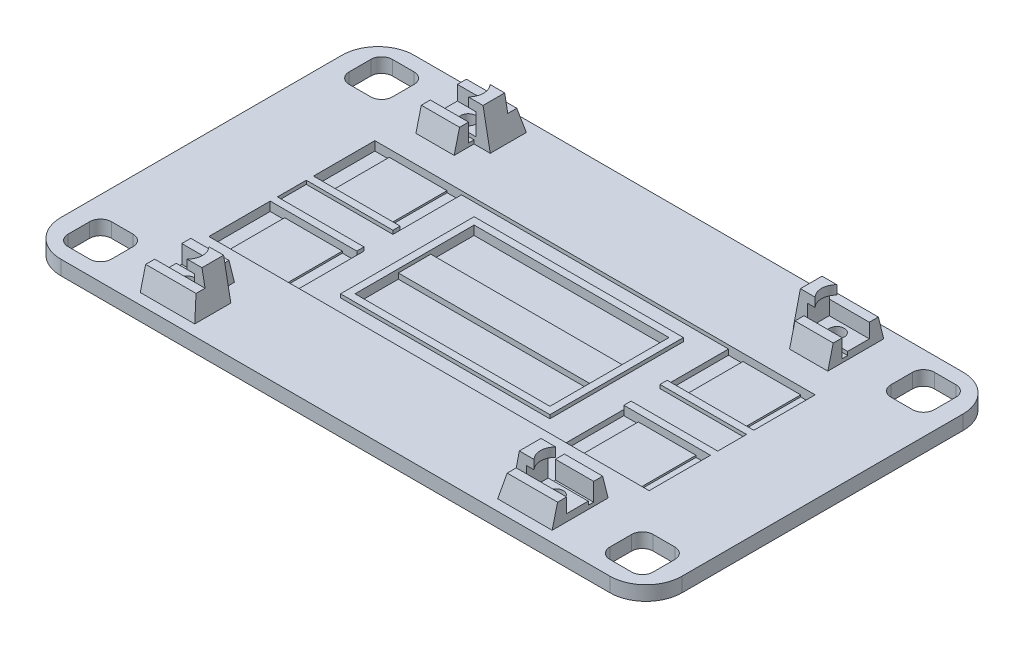
from build123d import *

# Parameters (mm, degrees)
SKETCH1_W                        = 34.5
SKETCH1_H                        = 8.741142107
BOSS_EXTRUDE3_DEPTH              = 4
SKETCH6_W                        = 11
SKETCH6_H                        = 11
BOSS_EXTRUDE4_DEPTH              = 2
CUT_EXTRUDE1_START               = -3
CUT_EXTRUDE1_DEPTH               = 24
SKETCH7_W                        = 11
SKETCH7_H                        = 2.5
SKETCH7_H_2                      = 1
BOSS_EXTRUDE5_DEPTH              = 4
SKETCH10_W                       = 3.083691557
SKETCH10_H                       = 13.597950321
CUT_EXTRUDE2_DEPTH               = 12
SKETCH11_W                       = 10.179154034
SKETCH11_H                       = 1.5
BOSS_EXTRUDE7_DEPTH              = 6
SKETCH12_W                       = 2.5
SKETCH12_H                       = 12.5
BOSS_EXTRUDE8_DEPTH              = 6
BOSS_EXTRUDE9_DEPTH              = 11.6
SKETCH21_R                       = 4.5
CUT_EXTRUDE9_DEPTH               = 3
CUT_EXTRUDE11_DEPTH              = 11.5
BOSS_EXTRUDE14_DEPTH             = 4
CUT_EXTRUDE12_START              = -1
SKETCH28_W                       = 13.111544153
SKETCH28_H                       = 1.5
CUT_EXTRUDE12_DEPTH              = 11
BOSS_EXTRUDE15_DEPTH             = 1.5
SKETCH30_W                       = 2.5
SKETCH30_H                       = 6
BOSS_EXTRUDE16_DEPTH             = 2
SKETCH31_W                       = 2.5
SKETCH31_H                       = 6
BOSS_EXTRUDE17_DEPTH             = 2.5
BOSS_EXTRUDE18_REACH             = 127.805
BOSS_EXTRUDE18_DIRECTION_2_REACH = 127.805
SKETCH34_W                       = 17.603907028
SKETCH34_H                       = 5.411961877
SKETCH34_H_2                     = 6.558600434
CUT_EXTRUDE13_DEPTH              = 4.5
BOSS_EXTRUDE20_DEPTH             = 11.6
MIRROR11_OUTLINE_R               = 4.5
MIRROR11_DEPTH                   = 3
MIRROR11_START                   = 3
MIRROR11_2_OUTLINE_R             = 2.069860115
MIRROR11_2_DEPTH                 = 1
MIRROR11_START_2                 = 4
MIRROR11_3_OUTLINE_R             = 2.069860115
MIRROR11_3_DEPTH                 = 2
MIRROR11_START_3                 = 6
MIRROR11_4_DEPTH                 = 4
MIRROR11_5_OUTLINE_W             = 13.1
MIRROR11_5_OUTLINE_H             = 1.5
MIRROR11_5_DEPTH                 = 1
MIRROR11_START_4                 = 12
MIRROR11_6_DEPTH                 = 2.5
MIRROR11_START_5                 = -59.844904725
MIRROR11_7_OUTLINE_W             = 6
MIRROR11_7_OUTLINE_H             = 2.5
MIRROR11_7_DEPTH                 = 15.1
MIRROR11_START_6                 = -49.244904725
MIRROR11_8_OUTLINE_W             = 10.5
MIRROR11_8_OUTLINE_H             = 6
MIRROR11_8_DEPTH                 = 4.5
MIRROR11_START_7                 = -46.744904725
MIRROR11_9_OUTLINE_W             = 6
MIRROR11_9_OUTLINE_H             = 1.5
MIRROR11_9_DEPTH                 = 2
MIRROR11_10_DEPTH                = 1.5
MIRROR11_START_8                 = -43.206197131
MIRROR11_11_DEPTH                = 3.206197131
BOSS_EXTRUDE21_REACH             = 154.22
CUT_EXTRUDE14_START              = -5
SKETCH37_W                       = 89.881860183
SKETCH37_H                       = 1.5
SKETCH37_W_2                     = 87.938782422
CUT_EXTRUDE14_DEPTH              = 5
SKETCH39_W                       = 7.636808492
SKETCH39_H                       = 7.005250269
CUT_EXTRUDE18_DEPTH              = 6
MIRROR13_COPY_1_SKETCH_W         = 7.636808492
MIRROR13_COPY_1_SKETCH_H         = 7.005250269
MIRROR13_COPY_1_DEPTH            = 6
SKETCH41_W                       = 6
SKETCH41_H                       = 6
CUT_EXTRUDE20_DEPTH              = 0.5
SKETCH42_W                       = 122
SKETCH42_H                       = 46
CUT_EXTRUDE21_DEPTH              = 1
SKETCH43_W                       = 24
SKETCH43_H                       = 2
BOSS_EXTRUDE23_DEPTH             = 1
SKETCH44_W                       = 4
SKETCH44_H                       = 17
CUT_EXTRUDE22_DEPTH              = 1.5
SKETCH45_W                       = 16
SKETCH45_H                       = 17
CUT_EXTRUDE23_DEPTH              = 1
SKETCH46_W                       = 58
SKETCH46_H                       = 37
SKETCH46_W_2                     = 54
SKETCH46_H_2                     = 33
BOSS_EXTRUDE25_DEPTH             = 1
SKETCH47_W                       = 54
SKETCH47_H                       = 12
CUT_EXTRUDE24_DEPTH              = 1.5


with BuildPart() as part:
    # Sketch1 → Boss-Extrude3 (new body)
    # profile 1 of 11: a face of its own
    with BuildSketch(Plane(origin=(0, 0, 0), x_dir=(1, 0, 0), z_dir=(0, 1, 0))):
        with BuildLine():
            Line((73.923306644, 42.779769086), (-59.063365063, 42.779769086))
            ThreePointArc((-59.063365063, 42.779769086), (-65.244285922, 40.219547838), (-67.804507169, 34.03862698))
            Line((-67.804507169, 34.03862698), (-67.804507169, -34.03862698))
            ThreePointArc((-67.804507169, -34.03862698), (-65.244285922, -40.219547838), (-59.063365063, -42.779769086))
            Line((-59.063365063, -42.779769086), (73.923306644, -42.779769086))
            ThreePointArc((73.923306644, -42.779769086), (80.104227503, -40.219547838), (82.664448751, -34.03862698))
            Line((82.664448751, -34.03862698), (82.664448751, 34.03862698))
            ThreePointArc((82.664448751, 34.03862698), (80.104227503, 40.219547838), (73.923306644, 42.779769086))
        make_face()
        with Locations((61.043877697, 34.03862698)):
            Rectangle(SKETCH1_W, SKETCH1_H, mode=Mode.SUBTRACT)
    # profile 2 of 11: a face of its own
    with BuildSketch(Plane(origin=(0, 0, 0), x_dir=(1, 0, 0), z_dir=(0, 1, 0))):
        with BuildLine():
            Line((78.293877697, 29.668055926), (78.293877697, 34.03862698))
            Line((78.293877697, 34.03862698), (74.273170351, 34.03862698))
            ThreePointArc((74.273170351, 34.03862698), (72.293877697, 32.059334326), (70.314585044, 34.03862698))
            Line((70.314585044, 34.03862698), (50.363737812, 34.03862698))
            ThreePointArc((50.363737812, 34.03862698), (48.293877697, 31.968766864), (46.224017582, 34.03862698))
            Line((46.224017582, 34.03862698), (43.793877697, 34.03862698))
            Line((43.793877697, 34.03862698), (43.793877697, 29.668055926))
            Line((43.793877697, 29.668055926), (78.293877697, 29.668055926))
        make_face()
    # profile 3 of 11: a face of its own
    with BuildSketch(Plane(origin=(0, 0, 0), x_dir=(1, 0, 0), z_dir=(0, 1, 0))):
        with BuildLine():
            Line((78.293877697, 34.03862698), (78.293877697, 38.409198033))
            Line((78.293877697, 38.409198033), (43.793877697, 38.409198033))
            Line((43.793877697, 38.409198033), (43.793877697, 34.03862698))
            Line((43.793877697, 34.03862698), (46.224017582, 34.03862698))
            ThreePointArc((46.224017582, 34.03862698), (48.293877697, 36.108487095), (50.363737812, 34.03862698))
            Line((50.363737812, 34.03862698), (70.314585044, 34.03862698))
            ThreePointArc((70.314585044, 34.03862698), (72.293877697, 36.017919633), (74.273170351, 34.03862698))
            Line((74.273170351, 34.03862698), (78.293877697, 34.03862698))
        make_face()
    # profile 4 of 11: a face of its own
    with BuildSketch(Plane(origin=(0, 0, 0), x_dir=(1, 0, 0), z_dir=(0, 1, 0))):
        with BuildLine():
            ThreePointArc((70.314585044, 34.03862698), (72.293877697, 32.059334326), (74.273170351, 34.03862698))
            Line((74.273170351, 34.03862698), (70.314585044, 34.03862698))
        make_face()
    # profile 5 of 11: a face of its own
    with BuildSketch(Plane(origin=(0, 0, 0), x_dir=(1, 0, 0), z_dir=(0, 1, 0))):
        with BuildLine():
            Line((70.314585044, 34.03862698), (74.273170351, 34.03862698))
            ThreePointArc((74.273170351, 34.03862698), (72.293877697, 36.017919633), (70.314585044, 34.03862698))
        make_face()
    # profile 6 of 11: a face of its own
    with BuildSketch(Plane(origin=(0, 0, 0), x_dir=(1, 0, 0), z_dir=(0, 1, 0))):
        with BuildLine():
            ThreePointArc((70.314585044, 34.03862698), (72.293877697, 32.059334326), (74.273170351, 34.03862698))
            Line((74.273170351, 34.03862698), (70.314585044, 34.03862698))
        make_face()
    # profile 7 of 11: a face of its own
    with BuildSketch(Plane(origin=(0, 0, 0), x_dir=(1, 0, 0), z_dir=(0, 1, 0))):
        with BuildLine():
            Line((70.314585044, 34.03862698), (74.273170351, 34.03862698))
            ThreePointArc((74.273170351, 34.03862698), (72.293877697, 36.017919633), (70.314585044, 34.03862698))
        make_face()
    # profile 8 of 11: a face of its own
    with BuildSketch(Plane(origin=(0, 0, 0), x_dir=(1, 0, 0), z_dir=(0, 1, 0))):
        with BuildLine():
            ThreePointArc((50.363737812, 34.03862698), (48.293877697, 36.108487095), (46.224017582, 34.03862698))
            Line((46.224017582, 34.03862698), (50.363737812, 34.03862698))
        make_face()
    # profile 9 of 11: a face of its own
    with BuildSketch(Plane(origin=(0, 0, 0), x_dir=(1, 0, 0), z_dir=(0, 1, 0))):
        with BuildLine():
            Line((50.363737812, 34.03862698), (46.224017582, 34.03862698))
            ThreePointArc((46.224017582, 34.03862698), (48.293877697, 31.968766864), (50.363737812, 34.03862698))
        make_face()
    # profile 10 of 11: a face of its own
    with BuildSketch(Plane(origin=(0, 0, 0), x_dir=(1, 0, 0), z_dir=(0, 1, 0))):
        with BuildLine():
            ThreePointArc((50.363737812, 34.03862698), (48.293877697, 36.108487095), (46.224017582, 34.03862698))
            Line((46.224017582, 34.03862698), (50.363737812, 34.03862698))
        make_face()
    # profile 11 of 11: a face of its own
    with BuildSketch(Plane(origin=(0, 0, 0), x_dir=(1, 0, 0), z_dir=(0, 1, 0))):
        with BuildLine():
            Line((50.363737812, 34.03862698), (46.224017582, 34.03862698))
            ThreePointArc((46.224017582, 34.03862698), (48.293877697, 31.968766864), (50.363737812, 34.03862698))
        make_face()
    extrude(amount=BOSS_EXTRUDE3_DEPTH)

    # Sketch6 → Boss-Extrude4 (add)
    with BuildSketch(Plane(origin=(0, 4, 0), x_dir=(1, 0, 0), z_dir=(0, 1, 0))):
        with Locations((48.114723663, 34.03862698)):
            Rectangle(SKETCH6_W, SKETCH6_H)
    boss_extrude4 = extrude(amount=BOSS_EXTRUDE4_DEPTH)

    # Sketch1<5> → Cut-Extrude1 (cut)
    with BuildSketch(Plane(origin=(0, 0, 0), x_dir=(1, 0, 0), z_dir=(0, 1, 0)).offset(CUT_EXTRUDE1_START)):
        with BuildLine():
            ThreePointArc((50.363737812, 34.03862698), (48.293877697, 36.108487095), (46.224017582, 34.03862698))
            Line((46.224017582, 34.03862698), (50.363737812, 34.03862698))
        make_face()
        with BuildLine():
            Line((50.363737812, 34.03862698), (46.224017582, 34.03862698))
            ThreePointArc((46.224017582, 34.03862698), (48.293877697, 31.968766864), (50.363737812, 34.03862698))
        make_face()
    cut_extrude1 = extrude(amount=CUT_EXTRUDE1_DEPTH, mode=Mode.SUBTRACT)

    # Sketch7 → Boss-Extrude5 (add)
    with BuildSketch(Plane(origin=(0, 6, 0), x_dir=(1, 0, 0), z_dir=(0, 1, 0))):
        with Locations((48.114723663, 38.28862698)):
            Rectangle(SKETCH7_W, SKETCH7_H)
        with Locations((48.114723663, 29.03862698)):
            Rectangle(SKETCH7_W, SKETCH7_H_2)
    boss_extrude5 = extrude(amount=BOSS_EXTRUDE5_DEPTH)

    # Sketch10 → Cut-Extrude2 (cut)
    with BuildSketch(Plane(origin=(0, 4, 0), x_dir=(1, 0, 0), z_dir=(0, 1, 0))):
        with Locations((54.335723476, 34.069991953)):
            Rectangle(SKETCH10_W, SKETCH10_H)
    cut_extrude2 = extrude(amount=CUT_EXTRUDE2_DEPTH, mode=Mode.SUBTRACT)

    # Sketch11 → Boss-Extrude7 (add)
    with BuildSketch(Plane(origin=(0, 4, 0), x_dir=(1, 0, 0), z_dir=(0, 1, 0))):
        with Locations((47.70430068, 27.78862698)):
            Rectangle(SKETCH11_W, SKETCH11_H)
    boss_extrude7 = extrude(amount=BOSS_EXTRUDE7_DEPTH)

    # Sketch12 → Boss-Extrude8 (add)
    with BuildSketch(Plane(origin=(0, 4, 0), x_dir=(1, 0, 0), z_dir=(0, 1, 0))):
        with Locations((42.443877697, 33.28862698)):
            Rectangle(SKETCH12_W, SKETCH12_H)
    boss_extrude8 = extrude(amount=BOSS_EXTRUDE8_DEPTH)

    # Sketch13 → Boss-Extrude9 (add)
    with BuildSketch(Plane.ZY.offset(-41.193877697)):
        Polygon((-27.03862698, 10), (-27.03862698, 4), (-25.53862698, 4), align=None)
        Polygon((-39.53862698, 10), (-39.53862698, 4), (-41.03862698, 4), align=None)
    extrude(amount=-BOSS_EXTRUDE9_DEPTH)

    # Sketch21 → Cut-Extrude9 (cut)
    with BuildSketch(Plane.XZ):
        with Locations(Location((48.293877697, -34.03862698, 0), (0, 0, 270))):
            Circle(SKETCH21_R)
    cut_extrude9 = extrude(amount=-CUT_EXTRUDE9_DEPTH, mode=Mode.SUBTRACT)

    # Sketch24 → Cut-Extrude11 (cut)
    with BuildSketch(Plane(origin=(0, 4, 0), x_dir=(1, 0, 0), z_dir=(0, 1, 0))):
        with BuildLine():
            Line((69.293877697, 40.03862698), (75.293877697, 40.03862698))
            ThreePointArc((75.293877697, 40.03862698), (77.415198041, 39.159947323), (78.293877697, 37.03862698))
            Line((78.293877697, 37.03862698), (78.293877697, 31.03862698))
            ThreePointArc((78.293877697, 31.03862698), (77.415198041, 28.917306636), (75.293877697, 28.03862698))
            Line((75.293877697, 28.03862698), (69.293877697, 28.03862698))
            ThreePointArc((69.293877697, 28.03862698), (67.172557354, 28.917306636), (66.293877697, 31.03862698))
            Line((66.293877697, 31.03862698), (66.293877697, 37.03862698))
            ThreePointArc((66.293877697, 37.03862698), (67.172557354, 39.159947323), (69.293877697, 40.03862698))
        make_face()
    cut_extrude11 = extrude(amount=-CUT_EXTRUDE11_DEPTH, mode=Mode.SUBTRACT)

    # Sketch26 → Boss-Extrude14 (add)
    with BuildSketch(Plane.XZ):
        with BuildLine():
            Line((-78.844904725, 53.842790723), (73.293877697, 53.842790723))
            ThreePointArc((73.293877697, 53.842790723), (80.364945509, 50.913858534), (83.293877697, 43.842790723))
            Line((83.293877697, 43.842790723), (83.293877697, -34.03862698))
            ThreePointArc((83.293877697, -34.03862698), (80.364945509, -41.109694791), (73.293877697, -44.03862698))
            Line((73.293877697, -44.03862698), (-78.844904725, -44.03862698))
            ThreePointArc((-78.844904725, -44.03862698), (-85.915972537, -41.109694791), (-88.844904725, -34.03862698))
            Line((-88.844904725, -34.03862698), (-88.844904725, 43.842790723))
            ThreePointArc((-88.844904725, 43.842790723), (-85.915972537, 50.913858534), (-78.844904725, 53.842790723))
        make_face()
        Polygon((39.621658068, -22.50744652), (81.471959084, -23.594467326), (79.917902441, -39.014138958), (77.090986998, -41.323408937), (59.598365076, -40.869055121), (39.621658068, -40.350179614), align=None, mode=Mode.SUBTRACT)
    extrude(amount=-BOSS_EXTRUDE14_DEPTH)

    # Sketch28 → Cut-Extrude12 (cut)
    with BuildSketch(Plane(origin=(0, 6, 0), x_dir=(1, 0, 0), z_dir=(0, 1, 0)).offset(CUT_EXTRUDE12_START)):
        with Locations((46.238105621, 30.28862698)):
            Rectangle(SKETCH28_W, SKETCH28_H)
    cut_extrude12 = extrude(amount=CUT_EXTRUDE12_DEPTH, mode=Mode.SUBTRACT)

    # Sketch29 → Boss-Extrude15 (add)
    with BuildSketch(Plane(origin=(52.793877697, 0, 0), x_dir=(0, 0, -1), z_dir=(1, 0, 0))):
        Polygon((37.03862698, 6), (31.03862698, 6), (31.03862698, 5), (29.53862698, 5), (29.53862698, 10), (27.03862698, 10), (25.53862698, 4), (41.03862698, 4), (39.53862698, 10), (37.03862698, 10), align=None)
    boss_extrude15 = extrude(amount=BOSS_EXTRUDE15_DEPTH)

    # Sketch30 → Boss-Extrude16 (add)
    with BuildSketch(Plane(origin=(0, 10, 0), x_dir=(1, 0, 0), z_dir=(0, 1, 0))):
        with Locations((42.443877697, 34.03862698)):
            Rectangle(SKETCH30_W, SKETCH30_H)
    boss_extrude16 = extrude(amount=BOSS_EXTRUDE16_DEPTH)

    # Sketch31 → Boss-Extrude17 (add)
    with BuildSketch(Plane(origin=(0, 12, 0), x_dir=(1, 0, 0), z_dir=(0, 1, 0))):
        with Locations((42.443877697, 34.03862698)):
            Rectangle(SKETCH31_W, SKETCH31_H)
        with BuildLine():
            Line((45.283479053, 37.03862698), (43.693877697, 37.03862698))
            Line((43.693877697, 37.03862698), (43.693877697, 31.03862698))
            Line((43.693877697, 31.03862698), (45.283479053, 31.03862698))
            ThreePointArc((45.283479053, 31.03862698), (44.043877697, 34.03862698), (45.283479053, 37.03862698))
        make_face()
    boss_extrude17 = extrude(amount=BOSS_EXTRUDE17_DEPTH)

    # Boss-Extrude18: up to this plane
    boss_extrude18_end = Plane(origin=(58.978536136, 4, -25.53862698), z_dir=(0, 0.2425356250363332, 0.9701425001453319))
    # Sketch33 → Boss-Extrude18 (add, up to the surface)
    with BuildSketch(Plane.XY.offset(-34.03862698), mode=Mode.PRIVATE) as boss_extrude18_sk1:
        Polygon((41.193877697, 14.5), (39.193877697, 4), (41.193877697, 4), align=None)
    boss_extrude18_tool1 = split(extrude(boss_extrude18_sk1.sketch, amount=BOSS_EXTRUDE18_REACH, mode=Mode.PRIVATE), bisect_by=boss_extrude18_end, keep=Keep.BOTH, mode=Mode.PRIVATE)
    boss_extrude18 = boss_extrude18_tool1.solids().sort_by_distance((40.527211, 7.5, -34.038627))[0]
    add(boss_extrude18)

    # Boss-Extrude18 direction 2: up to this plane
    boss_extrude18_direction_2_end = Plane(origin=(58.978536136, 4, -41.03862698), z_dir=(0, 0.2425356250363332, -0.9701425001453319))
    # Sketch33 → Boss-Extrude18 direction 2 (add, up to the surface)
    with BuildSketch(Plane.XY.offset(-34.03862698), mode=Mode.PRIVATE) as boss_extrude18_direction_2_sk1:
        Polygon((41.193877697, 14.5), (39.193877697, 4), (41.193877697, 4), align=None)
    boss_extrude18_direction_2_tool1 = split(extrude(boss_extrude18_direction_2_sk1.sketch, amount=-BOSS_EXTRUDE18_DIRECTION_2_REACH, mode=Mode.PRIVATE), bisect_by=boss_extrude18_direction_2_end, keep=Keep.BOTH, mode=Mode.PRIVATE)
    boss_extrude18_direction_2 = boss_extrude18_direction_2_tool1.solids().sort_by_distance((40.527211, 7.5, -34.038627))[0]
    add(boss_extrude18_direction_2)
    boss_extrude18 = boss_extrude18 + boss_extrude18_direction_2  # both directions under the feature's name, for the pattern or mirror that repeats it

    # Sketch34 → Cut-Extrude13 (cut)
    with BuildSketch(Plane(origin=(0, 14.5, 0), x_dir=(1, 0, 0), z_dir=(0, 1, 0))):
        with Locations((45.491924183, 39.744607919)):
            Rectangle(SKETCH34_W, SKETCH34_H)
        with Locations((45.491924183, 27.759326763)):
            Rectangle(SKETCH34_W, SKETCH34_H_2)
    cut_extrude13 = extrude(amount=-CUT_EXTRUDE13_DEPTH, mode=Mode.SUBTRACT)

    # Mirror9: Boss-Extrude4, Cut-Extrude1, Boss-Extrude5, Cut-Extrude2, Boss-Extrude7, Boss-Extrude8, Cut-Extrude9, Cut-Extrude11, Cut-Extrude12, Boss-Extrude15, Boss-Extrude16, Boss-Extrude17, Boss-Extrude18, Cut-Extrude13 across plane
    add(boss_extrude4.mirror(Plane.XY.offset(4.902081871)))
    add(cut_extrude1.mirror(Plane.XY.offset(4.902081871)), mode=Mode.SUBTRACT)
    add(boss_extrude5.mirror(Plane.XY.offset(4.902081871)))
    add(cut_extrude2.mirror(Plane.XY.offset(4.902081871)), mode=Mode.SUBTRACT)
    add(boss_extrude7.mirror(Plane.XY.offset(4.902081871)))
    add(boss_extrude8.mirror(Plane.XY.offset(4.902081871)))
    add(cut_extrude9.mirror(Plane.XY.offset(4.902081871)), mode=Mode.SUBTRACT)
    add(cut_extrude11.mirror(Plane.XY.offset(4.902081871)), mode=Mode.SUBTRACT)
    add(cut_extrude12.mirror(Plane.XY.offset(4.902081871)), mode=Mode.SUBTRACT)
    add(boss_extrude15.mirror(Plane.XY.offset(4.902081871)))
    add(boss_extrude16.mirror(Plane.XY.offset(4.902081871)))
    add(boss_extrude17.mirror(Plane.XY.offset(4.902081871)))
    add(boss_extrude18.mirror(Plane.XY.offset(4.902081871)))
    add(cut_extrude13.mirror(Plane.XY.offset(4.902081871)), mode=Mode.SUBTRACT)

    # Sketch35 → Boss-Extrude20 (add)
    with BuildSketch(Plane.ZY.offset(-52.793877697)):
        Polygon((35.342790723, 4), (36.842790723, 4), (36.842790723, 10), align=None)
        Polygon((50.842790723, 4), (49.342790723, 10), (49.342790723, 4), align=None)
    extrude(amount=BOSS_EXTRUDE20_DEPTH)

    # Mirror11: read off the stored shape, not the designer's step
    # Mirror11 outline → Mirror11 (cut)
    with BuildSketch(Plane(origin=(0, 0, 0), x_dir=(1, 0, 0), z_dir=(0, 1, 0))):
        with Locations((-53.844904725, 34.03862698)):
            Circle(MIRROR11_OUTLINE_R)
        with Locations((-53.844904725, -43.842790723)):
            Circle(MIRROR11_OUTLINE_R)
        with BuildLine():
            Line((-74.844904725, 40.03862698), (-80.844904725, 40.03862698))
            ThreePointArc((-80.844904725, 40.03862698), (-82.966225069, 39.159947323), (-83.844904725, 37.03862698))
            Line((-83.844904725, 37.03862698), (-83.844904725, 31.03862698))
            ThreePointArc((-83.844904725, 31.03862698), (-82.966225069, 28.917306636), (-80.844904725, 28.03862698))
            Line((-80.844904725, 28.03862698), (-74.844904725, 28.03862698))
            ThreePointArc((-74.844904725, 28.03862698), (-72.723584382, 28.917306636), (-71.844904725, 31.03862698))
            Line((-71.844904725, 31.03862698), (-71.844904725, 37.03862698))
            ThreePointArc((-71.844904725, 37.03862698), (-72.723584382, 39.159947323), (-74.844904725, 40.03862698))
        make_face()
        with BuildLine():
            ThreePointArc((-71.844904725, -40.842790723), (-72.723584382, -38.721470379), (-74.844904725, -37.842790723))
            Line((-74.844904725, -37.842790723), (-80.844904725, -37.842790723))
            ThreePointArc((-80.844904725, -37.842790723), (-82.966225069, -38.721470379), (-83.844904725, -40.842790723))
            Line((-83.844904725, -40.842790723), (-83.844904725, -46.842790723))
            ThreePointArc((-83.844904725, -46.842790723), (-82.966225069, -48.964111066), (-80.844904725, -49.842790723))
            Line((-80.844904725, -49.842790723), (-74.844904725, -49.842790723))
            ThreePointArc((-74.844904725, -49.842790723), (-72.723584382, -48.964111066), (-71.844904725, -46.842790723))
            Line((-71.844904725, -46.842790723), (-71.844904725, -40.842790723))
        make_face()
    extrude(amount=MIRROR11_DEPTH, mode=Mode.SUBTRACT)

    # Mirror11 2 outline → Mirror11 2 (cut)
    with BuildSketch(Plane(origin=(0, 0, 0), x_dir=(1, 0, 0), z_dir=(0, 1, 0)).offset(MIRROR11_START)):
        with Locations((-53.844904725, 34.03862698)):
            Circle(MIRROR11_2_OUTLINE_R)
        with Locations((-53.844904725, -43.842790723)):
            Circle(MIRROR11_2_OUTLINE_R)
        with BuildLine():
            Line((-74.844904725, 40.03862698), (-80.844904725, 40.03862698))
            ThreePointArc((-80.844904725, 40.03862698), (-82.966225069, 39.159947323), (-83.844904725, 37.03862698))
            Line((-83.844904725, 37.03862698), (-83.844904725, 31.03862698))
            ThreePointArc((-83.844904725, 31.03862698), (-82.966225069, 28.917306636), (-80.844904725, 28.03862698))
            Line((-80.844904725, 28.03862698), (-74.844904725, 28.03862698))
            ThreePointArc((-74.844904725, 28.03862698), (-72.723584382, 28.917306636), (-71.844904725, 31.03862698))
            Line((-71.844904725, 31.03862698), (-71.844904725, 37.03862698))
            ThreePointArc((-71.844904725, 37.03862698), (-72.723584382, 39.159947323), (-74.844904725, 40.03862698))
        make_face()
        with BuildLine():
            ThreePointArc((-71.844904725, -40.842790723), (-72.723584382, -38.721470379), (-74.844904725, -37.842790723))
            Line((-74.844904725, -37.842790723), (-80.844904725, -37.842790723))
            ThreePointArc((-80.844904725, -37.842790723), (-82.966225069, -38.721470379), (-83.844904725, -40.842790723))
            Line((-83.844904725, -40.842790723), (-83.844904725, -46.842790723))
            ThreePointArc((-83.844904725, -46.842790723), (-82.966225069, -48.964111066), (-80.844904725, -49.842790723))
            Line((-80.844904725, -49.842790723), (-74.844904725, -49.842790723))
            ThreePointArc((-74.844904725, -49.842790723), (-72.723584382, -48.964111066), (-71.844904725, -46.842790723))
            Line((-71.844904725, -46.842790723), (-71.844904725, -40.842790723))
        make_face()
    extrude(amount=MIRROR11_2_DEPTH, mode=Mode.SUBTRACT)

    # Mirror11 3 outline → Mirror11 3 (add)
    # profile 1 of 2: a face of its own
    with BuildSketch(Plane(origin=(0, 0, 0), x_dir=(1, 0, 0), z_dir=(0, 1, 0)).offset(MIRROR11_START_2)):
        with BuildLine():
            Line((-50.490802759, -46.842790723), (-49.244904725, -46.842790723))
            Line((-49.244904725, -46.842790723), (-49.244904725, -40.842790723))
            Line((-49.244904725, -40.842790723), (-59.844904725, -40.842790723))
            Line((-59.844904725, -40.842790723), (-59.844904725, -46.842790723))
            Line((-59.844904725, -46.842790723), (-57.199006691, -46.842790723))
            ThreePointArc((-57.199006691, -46.842790723), (-53.844904725, -48.342790723), (-50.490802759, -46.842790723))
        make_face()
        with Locations((-53.844904725, -43.842790723)):
            Circle(MIRROR11_3_OUTLINE_R, mode=Mode.SUBTRACT)
    # profile 2 of 2: a face of its own
    with BuildSketch(Plane(origin=(0, 0, 0), x_dir=(1, 0, 0), z_dir=(0, 1, 0)).offset(MIRROR11_START_2)):
        with BuildLine():
            Line((-49.244904725, 31.03862698), (-49.244904725, 37.03862698))
            Line((-49.244904725, 37.03862698), (-50.490802759, 37.03862698))
            ThreePointArc((-50.490802759, 37.03862698), (-53.844904725, 38.53862698), (-57.199006691, 37.03862698))
            Line((-57.199006691, 37.03862698), (-59.844904725, 37.03862698))
            Line((-59.844904725, 37.03862698), (-59.844904725, 31.03862698))
            Line((-59.844904725, 31.03862698), (-49.244904725, 31.03862698))
        make_face()
        with Locations((-53.844904725, 34.03862698)):
            Circle(MIRROR11_3_OUTLINE_R, mode=Mode.SUBTRACT)
    extrude(amount=MIRROR11_3_DEPTH)

    # Mirror11 4 outline → Mirror11 4 (add)
    with BuildSketch(Plane(origin=(0, 0, 0), x_dir=(1, 0, 0), z_dir=(0, 1, 0)).offset(MIRROR11_START_3)):
        with BuildLine():
            ThreePointArc((-57.199006691, -46.842790723), (-53.844904725, -48.342790723), (-50.490802759, -46.842790723))
            Line((-50.490802759, -46.842790723), (-57.199006691, -46.842790723))
        make_face()
        with BuildLine():
            Line((-57.199006691, 37.03862698), (-50.490802759, 37.03862698))
            ThreePointArc((-50.490802759, 37.03862698), (-53.844904725, 38.53862698), (-57.199006691, 37.03862698))
        make_face()
    extrude(amount=MIRROR11_4_DEPTH)

    # Mirror11 5 outline → Mirror11 5 (add)
    with BuildSketch(Plane(origin=(0, 0, 0), x_dir=(1, 0, 0), z_dir=(0, 1, 0)).offset(MIRROR11_START_2)):
        with Locations((-53.294904725, -40.092790723)):
            Rectangle(MIRROR11_5_OUTLINE_W, MIRROR11_5_OUTLINE_H)
        with Locations((-53.294904725, 30.28862698)):
            Rectangle(MIRROR11_5_OUTLINE_W, MIRROR11_5_OUTLINE_H)
    extrude(amount=MIRROR11_5_DEPTH)

    # Mirror11 7 outline → Mirror11 7 (add)
    with BuildSketch(Plane.YZ.offset(MIRROR11_START_5)):
        Polygon((4, 39.342790723), (4, 35.342790723), (10, 36.842790723), (10, 39.342790723), align=None)
        with Locations((7, -28.28862698)):
            Rectangle(MIRROR11_7_OUTLINE_W, MIRROR11_7_OUTLINE_H)
        with Locations((7, -38.28862698)):
            Rectangle(MIRROR11_7_OUTLINE_W, MIRROR11_7_OUTLINE_H)
        Polygon((4, 50.842790723), (4, 46.842790723), (10, 46.842790723), (10, 49.342790723), align=None)
    extrude(amount=MIRROR11_7_DEPTH)



with BuildPart() as body_2:
    # Mirror11 6 outline → Mirror11 6 (new body)
    with BuildSketch(Plane(origin=(0, 0, 0), x_dir=(1, 0, 0), z_dir=(0, 1, 0)).offset(MIRROR11_START_4)):
        with BuildLine():
            Line((-49.244904725, -46.842790723), (-49.244904725, -40.842790723))
            Line((-49.244904725, -40.842790723), (-50.834506081, -40.842790723))
            ThreePointArc((-50.834506081, -40.842790723), (-49.594904725, -43.842790723), (-50.834506081, -46.842790723))
            Line((-50.834506081, -46.842790723), (-49.244904725, -46.842790723))
        make_face()
        with BuildLine():
            Line((-49.244904725, 31.03862698), (-49.244904725, 37.03862698))
            Line((-49.244904725, 37.03862698), (-50.834506081, 37.03862698))
            ThreePointArc((-50.834506081, 37.03862698), (-49.594904725, 34.03862698), (-50.834506081, 31.03862698))
            Line((-50.834506081, 31.03862698), (-49.244904725, 31.03862698))
        make_face()
    extrude(amount=MIRROR11_6_DEPTH)


with BuildPart() as part_1:
    add(part.part)

    add(body_2.part)  # Mirror11 8 merges body 2
    # Mirror11 8 outline → Mirror11 8 (add)
    with BuildSketch(Plane.YZ.offset(MIRROR11_START_6)):
        with Locations((9.25, -34.03862698)):
            Rectangle(MIRROR11_8_OUTLINE_W, MIRROR11_8_OUTLINE_H)
        with Locations((9.25, 43.842790723)):
            Rectangle(MIRROR11_8_OUTLINE_W, MIRROR11_8_OUTLINE_H)
    extrude(amount=MIRROR11_8_DEPTH)

    # Mirror11 9 outline → Mirror11 9 (add)
    with BuildSketch(Plane.YZ.offset(MIRROR11_START_7)):
        with Locations((7, -30.28862698)):
            Rectangle(MIRROR11_9_OUTLINE_W, MIRROR11_9_OUTLINE_H)
        Polygon((4, -27.03862698), (10, -27.03862698), (4, -25.53862698), align=None)
        with Locations((7, 40.092790723)):
            Rectangle(MIRROR11_9_OUTLINE_W, MIRROR11_9_OUTLINE_H)
        Polygon((10, -39.53862698), (4, -39.53862698), (4, -41.03862698), align=None)
    extrude(amount=MIRROR11_9_DEPTH)

    # Mirror11 10 outline → Mirror11 10 (add)
    with BuildSketch(Plane.YZ.offset(MIRROR11_START_5)):
        Polygon((4, -27.03862698), (10, -27.03862698), (4, -25.53862698), align=None)
        Polygon((10, -39.53862698), (4, -39.53862698), (4, -41.03862698), align=None)
    extrude(amount=MIRROR11_10_DEPTH)

    # Mirror11 11 outline → Mirror11 11 (cut)
    with BuildSketch(Plane(origin=(0, 0, 0), x_dir=(-0.18711210788999502, 0.9823385664224749, 0), z_dir=(0.9823385664224749, 0.187112107889995, 0)).offset(MIRROR11_START_8)):
        Polygon((12.301667706, -41.03862698), (18.409541514, -39.53862698), (18.409541514, -37.03862698), (22.990446869, -37.03862698), (22.990446869, -31.03862698), (18.409541514, -31.03862698), (18.409541514, -27.03862698), (12.301667706, -25.53862698), align=None)
        Polygon((22.990446869, 40.842790723), (22.990446869, 46.842790723), (18.409541514, 46.842790723), (18.409541514, 49.342790723), (12.301667706, 50.842790723), (12.301667706, 35.342790723), (18.409541514, 36.842790723), (18.409541514, 40.842790723), align=None)
    extrude(amount=MIRROR11_11_DEPTH, mode=Mode.SUBTRACT)

    # Boss-Extrude21: up to this face of the body (flat: up to its plane)
    boss_extrude21_end = Plane(part_1.part.faces().sort_by_distance((-45.544132525, 8.195945946, -33.471059412))[0])
    # Sketch36 → Boss-Extrude21 (add, up to the picked face)
    with BuildSketch(Plane(origin=(-58.344904725, 0, 0), x_dir=(0, 0, -1), z_dir=(1, 0, 0)), mode=Mode.PRIVATE) as boss_extrude21_sk1:
        Polygon((41.03862698, 4), (39.53862698, 10), (39.53862698, 4), align=None)
    boss_extrude21_tool1 = split(extrude(boss_extrude21_sk1.sketch, amount=BOSS_EXTRUDE21_REACH, mode=Mode.PRIVATE), bisect_by=boss_extrude21_end, keep=Keep.BOTH, mode=Mode.PRIVATE)
    # Sketch36 → Boss-Extrude21 (add, up to the picked face)
    with BuildSketch(Plane(origin=(-58.344904725, 0, 0), x_dir=(0, 0, -1), z_dir=(1, 0, 0)), mode=Mode.PRIVATE) as boss_extrude21_sk2:
        Polygon((25.53862698, 4), (27.03862698, 4), (27.03862698, 10), align=None)
    boss_extrude21_tool2 = split(extrude(boss_extrude21_sk2.sketch, amount=BOSS_EXTRUDE21_REACH, mode=Mode.PRIVATE), bisect_by=boss_extrude21_end, keep=Keep.BOTH, mode=Mode.PRIVATE)
    add(boss_extrude21_tool1.solids().sort_by(Axis((-58.344905, 6, -40.038627), (1, 0, 0)))[0])
    add(boss_extrude21_tool2.solids().sort_by(Axis((-58.344905, 6, -26.538627), (1, 0, 0)))[0])

    # Sketch37 → Cut-Extrude14 (cut)
    with BuildSketch(Plane(origin=(0, 10, 0), x_dir=(1, 0, 0), z_dir=(0, 1, 0)).offset(CUT_EXTRUDE14_START)):
        with Locations((-3.747052394, -40.092790723)):
            Rectangle(SKETCH37_W, SKETCH37_H)
        with Locations((-2.775513514, 30.28862698)):
            Rectangle(SKETCH37_W_2, SKETCH37_H)
    extrude(amount=CUT_EXTRUDE14_DEPTH, mode=Mode.SUBTRACT)

    # Sketch39 → Cut-Extrude18 (cut)
    with BuildSketch(Plane(origin=(0, 10, 0), x_dir=(1, 0, 0), z_dir=(0, 1, 0))):
        with Locations((-45.426500479, -37.340165588)):
            Rectangle(SKETCH39_W, SKETCH39_H)
    cut_extrude18 = extrude(amount=-CUT_EXTRUDE18_DEPTH, mode=Mode.SUBTRACT)

    # Mirror12: Cut-Extrude18 across plane
    add(cut_extrude18.mirror(Plane.XY.offset(4.902081871)), mode=Mode.SUBTRACT)

    # Mirror13: Cut-Extrude18 across plane
    add(cut_extrude18.mirror(Plane.ZY.offset(2.775513514)), mode=Mode.SUBTRACT)

    # Mirror13 copy 1 sketch → Mirror13 copy 1 (cut)
    with BuildSketch(Plane(origin=(-5.551027028, 10, 9.804163743), x_dir=(-1, 0, 0), z_dir=(0, 1, 0))):
        with Locations((-45.426500479, -37.340165588)):
            Rectangle(MIRROR13_COPY_1_SKETCH_W, MIRROR13_COPY_1_SKETCH_H)
    extrude(amount=-MIRROR13_COPY_1_DEPTH, mode=Mode.SUBTRACT)

    # Sketch41 → Cut-Extrude20 (cut)
    with BuildSketch(Plane(origin=(43.693877697, 0, 0), x_dir=(0, 0, -1), z_dir=(1, 0, 0))):
        with Locations((34.03862698, 9)):
            Rectangle(SKETCH41_W, SKETCH41_H)
        with Locations((-43.842790723, 9)):
            Rectangle(SKETCH41_W, SKETCH41_H)
    cut_extrude20 = extrude(amount=-CUT_EXTRUDE20_DEPTH, mode=Mode.SUBTRACT)

    # Mirror14: Cut-Extrude20 across plane
    add(cut_extrude20.mirror(Plane.ZY.offset(2.775513514)), mode=Mode.SUBTRACT)

    # Sketch42 → Cut-Extrude21 (cut)
    with BuildSketch(Plane(origin=(0, 4, 0), x_dir=(1, 0, 0), z_dir=(0, 1, 0))):
        with Locations((-2.775513514, -4.902081871)):
            Rectangle(SKETCH42_W, SKETCH42_H)
    extrude(amount=-CUT_EXTRUDE21_DEPTH, mode=Mode.SUBTRACT)

    # Sketch43 → Boss-Extrude23 (add)
    with BuildSketch(Plane(origin=(0, 3, 0), x_dir=(1, 0, 0), z_dir=(0, 1, 0))):
        with Locations((-51.775513514, -9.902081871)):
            Rectangle(SKETCH43_W, SKETCH43_H)
        with Locations((-51.775513514, 0.097918129)):
            Rectangle(SKETCH43_W, SKETCH43_H)
        with Locations((46.224486486, 0.097918129)):
            Rectangle(SKETCH43_W, SKETCH43_H)
        with Locations((46.224486486, -9.902081871)):
            Rectangle(SKETCH43_W, SKETCH43_H)
    extrude(amount=BOSS_EXTRUDE23_DEPTH)

    # Sketch44 → Cut-Extrude22 (cut)
    with BuildSketch(Plane(origin=(0, 3, 0), x_dir=(1, 0, 0), z_dir=(0, 1, 0))):
        with Locations((-61.775513514, -19.402081871)):
            Rectangle(SKETCH44_W, SKETCH44_H)
        with Locations((-41.775513514, -19.402081871)):
            Rectangle(SKETCH44_W, SKETCH44_H)
        with Locations((-61.775513514, 9.597918129)):
            Rectangle(SKETCH44_W, SKETCH44_H)
        with Locations((-41.775513514, 9.597918129)):
            Rectangle(SKETCH44_W, SKETCH44_H)
        with Locations((36.224486486, 9.597918129)):
            Rectangle(SKETCH44_W, SKETCH44_H)
        with Locations((56.224486486, 9.597918129)):
            Rectangle(SKETCH44_W, SKETCH44_H)
        with Locations((36.224486486, -19.402081871)):
            Rectangle(SKETCH44_W, SKETCH44_H)
        with Locations((56.224486486, -19.402081871)):
            Rectangle(SKETCH44_W, SKETCH44_H)
    extrude(amount=-CUT_EXTRUDE22_DEPTH, mode=Mode.SUBTRACT)

    # Sketch45 → Cut-Extrude23 (cut)
    with BuildSketch(Plane(origin=(0, 3, 0), x_dir=(1, 0, 0), z_dir=(0, 1, 0))):
        with Locations((-51.775513514, 9.597918129)):
            Rectangle(SKETCH45_W, SKETCH45_H)
        with Locations((-51.775513514, -19.402081871)):
            Rectangle(SKETCH45_W, SKETCH45_H)
        with Locations((46.224486486, 9.597918129)):
            Rectangle(SKETCH45_W, SKETCH45_H)
        with Locations((46.224486486, -19.402081871)):
            Rectangle(SKETCH45_W, SKETCH45_H)
    extrude(amount=-CUT_EXTRUDE23_DEPTH, mode=Mode.SUBTRACT)

    # Sketch46 → Boss-Extrude25 (add)
    with BuildSketch(Plane(origin=(0, 3, 0), x_dir=(1, 0, 0), z_dir=(0, 1, 0))):
        with Locations((-2.775513514, -4.902081871)):
            Rectangle(SKETCH46_W, SKETCH46_H)
        with Locations((-2.775513514, -4.902081871)):
            Rectangle(SKETCH46_W_2, SKETCH46_H_2, mode=Mode.SUBTRACT)
    extrude(amount=BOSS_EXTRUDE25_DEPTH)

    # Sketch47 → Cut-Extrude24 (cut)
    with BuildSketch(Plane(origin=(0, 3, 0), x_dir=(1, 0, 0), z_dir=(0, 1, 0))):
        with Locations((-2.775513514, 5.597918129)):
            Rectangle(SKETCH47_W, SKETCH47_H)
        with Locations((-2.775513514, -15.402081871)):
            Rectangle(SKETCH47_W, SKETCH47_H)
    extrude(amount=-CUT_EXTRUDE24_DEPTH, mode=Mode.SUBTRACT)


solid = part_1.part
